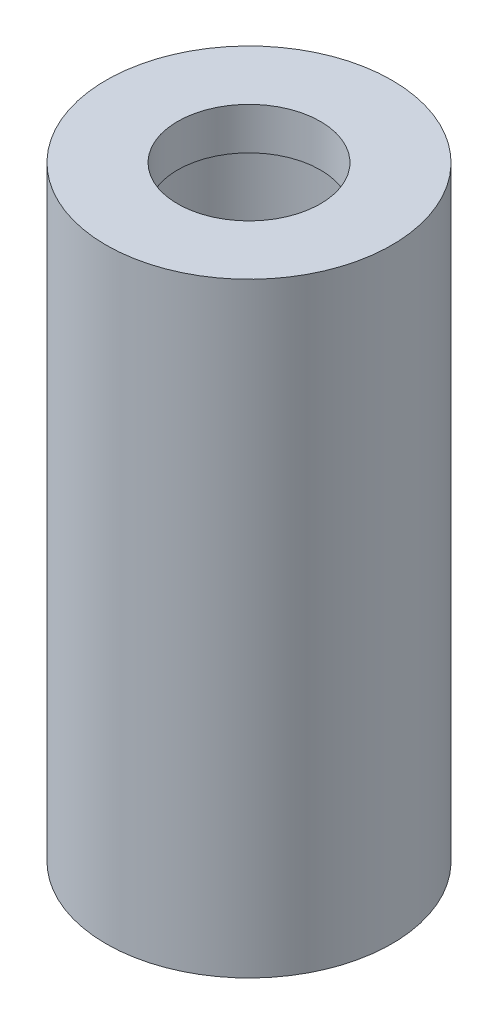
from build123d import *

# Parameters (mm, degrees)
SKETCH3_R          = 2.032
CUT_EXTRUDE1_DEPTH = 20.28059107


with BuildPart() as part:
    # Sketch2 → Revolve1 (revolve)
    with BuildSketch(Plane.XY):
        Polygon((3.175, 0), (4.318, 0), (4.318, 18.288), (2.159, 18.288), (2.159, 17.018), (2.921, 17.018), (2.921, 12.7), (3.175, 12.7), align=None)
    revolve(axis=Axis((0, 0, 0), (0, 1, 0)))

    # Sketch3 → Cut-Extrude1 (cut, through all)
    with BuildSketch(Plane.XY):
        with Locations((0, 8.128)):
            Circle(SKETCH3_R)
    extrude(amount=-CUT_EXTRUDE1_DEPTH, mode=Mode.SUBTRACT)


solid = part.part
